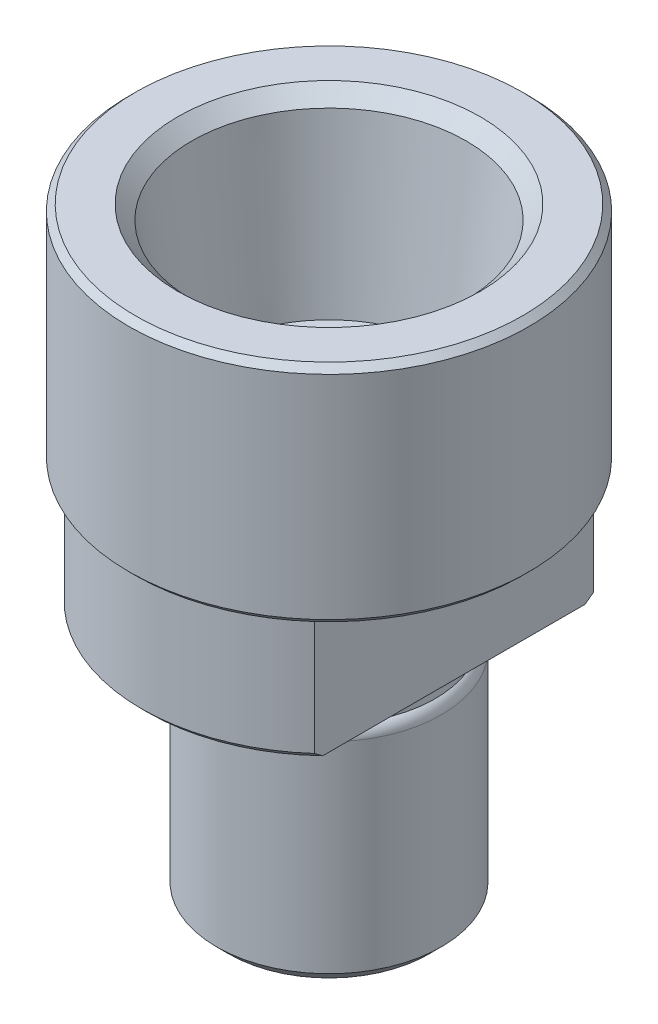
from build123d import *

# Parameters (mm, degrees)
CHAFL_N1_SIZE         = 1
REDONDEO1_R           = 1
CHAFL_N2_SIZE         = 0.5
CROQUIS3_W            = 14.730869345
CROQUIS3_H            = 22.360679774
CORTAR_EXTRUIR1_DEPTH = 30
CHAFL_N3_SIZE         = 1
CHAFL_N3_SIZE2        = 1.12675647


with BuildPart() as part:
    # Croquis1 → Revolución1 (revolve)
    with BuildSketch(Plane.XY, mode=Mode.PRIVATE) as revoluci_n1_sk:
        Polygon((11.11, 48), (16, 48), (16, 30), (15, 30), (15, 20), (8.5, 20), (8.5, 17.951688966), (9, 17.951688966), (9, 0), (4.7625, 0), (4.7625, 32.24119236), (5.7625, 33.24119236), (9.525, 33.24119236), align=None)
    revolve(revoluci_n1_sk.sketch.rotate(Axis((0, 50.374990084, 0), (0, -1, 0)), 90), axis=Axis((0, 50.374990084, 0), (0, -1, 0)))

    # Chaflán1
    chafl_n1_edges = [part.edges().sort_by_distance(p)[0] for p in [
        (0, 0, -9),
    ]]
    chamfer(chafl_n1_edges, length=CHAFL_N1_SIZE)

    # Redondeo1
    # the kernel refuses this fillet: 1 mm, written as the material it takes off along each edge
    with BuildSketch(Plane(origin=(0, 17.951688966, 0), x_dir=(0, 0, 1), z_dir=(1, 0, 0))) as redondeo1_piece_1:
        with BuildLine():
            CenterArc((8, 0.866025404), REDONDEO1_R, 300, 60)
            Line((8.5, 0), (8.51, -0.017320508))
            ThreePointArc((8.51, -0.017320508), (8.75, -0.02), (9, -0.02))
            Line((9, -0.02), (9.02, 0))
            Line((9.02, 0), (9.02, 0.866025404))
            Line((9.02, 0.866025404), (9, 0.866025404))
        make_face()
    revolve(axis=Axis((0, 17.951688966, 0), (0, -1, 0)), mode=Mode.SUBTRACT)

    # Chaflán2
    chafl_n2_edges = [part.edges().sort_by_distance(p)[0] for p in [
        (0, 20, -15),
        (0, 30, -16),
        (0, 48, -16),
    ]]
    chamfer(chafl_n2_edges, length=CHAFL_N2_SIZE)

    # Croquis3 → Cortar-Extruir1 (cut)
    with BuildSketch(Plane.XZ):
        Polygon((10, 11.180339887), (10, -11.180339887), (24.245950338, -11.180339887), (24.827853146, 11.180339887), align=None)
        with Locations((-17.365434673, 0)):
            Rectangle(CROQUIS3_W, CROQUIS3_H)
    extrude(amount=-CORTAR_EXTRUIR1_DEPTH, mode=Mode.SUBTRACT)

    # Chaflán3
    chafl_n3_edges = [part.edges().sort_by_distance(p)[0] for p in [
        (0, 48, -11.11),
    ]]
    chafl_n3_side = [part.faces().sort_by_distance(p)[0] for p in [
        (0, 48, -15.061593796),
    ]]
    chamfer(chafl_n3_edges, length=CHAFL_N3_SIZE, length2=CHAFL_N3_SIZE2, reference=chafl_n3_side[0])


solid = part.part
